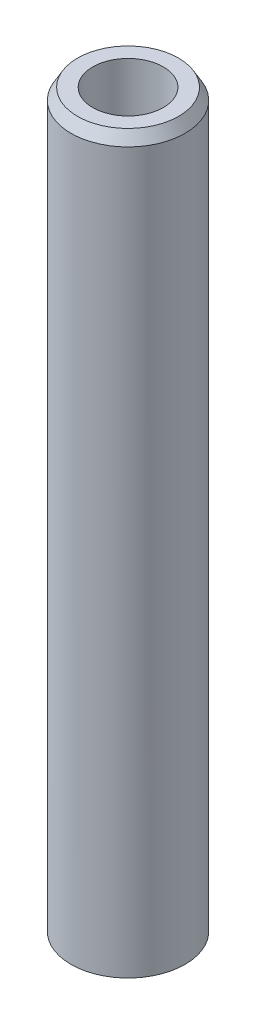
from build123d import *
from OCP.BRepFilletAPI import BRepFilletAPI_MakeChamfer

# Parameters (mm, degrees)
SKETCH1_R           = 25
BOSS_EXTRUDE1_DEPTH = 323.019459308
SKETCH2_R           = 15.452771336
CUT_EXTRUDE1_DEPTH  = 325.94856684
CHAMFER1_SIZE       = 4.986464527
CHAMFER1_SIZE2      = 2.878936637


with BuildPart() as part:
    # Sketch1 → Boss-Extrude1 (new body)
    with BuildSketch(Plane(origin=(0, 0, 0), x_dir=(1, 0, 0), z_dir=(0, 1, 0))):
        Circle(SKETCH1_R)
    extrude(amount=BOSS_EXTRUDE1_DEPTH)

    # Sketch2 → Cut-Extrude1 (cut, through all)
    with BuildSketch(Plane(origin=(0, 0, 0), x_dir=(1, 0, 0), z_dir=(0, 1, 0))):
        Circle(SKETCH2_R)
    extrude(amount=CUT_EXTRUDE1_DEPTH, mode=Mode.SUBTRACT)

    # Chamfer1: one chamfer whose edges measure the first distance from different faces: ONE call of the kernel's chamfer builder (chamfer() names one face for all edges)
    chamfer1_edges_1 = [part.edges().sort_by_distance(p)[0] for p in [
        (-25, 323.019459308, 0),
    ]]
    chamfer1_side_1 = [part.faces().sort_by_distance(p)[0] for p in [
        (-25, 161.509729654, 0),
    ]]
    chamfer1_edges_2 = [part.edges().sort_by_distance(p)[0] for p in [
        (-25, 0, 0),
    ]]
    chamfer1_side_2 = [part.faces().sort_by_distance(p)[0] for p in [
        (-24.292893219, 0, 0),
    ]]
    chamfer1 = BRepFilletAPI_MakeChamfer(part.part.solid().wrapped)
    for e in chamfer1_edges_1:
        chamfer1.Add(CHAMFER1_SIZE, CHAMFER1_SIZE2, e.wrapped, chamfer1_side_1[0].wrapped)  # the first distance lies on this face
    for e in chamfer1_edges_2:
        chamfer1.Add(CHAMFER1_SIZE, CHAMFER1_SIZE2, e.wrapped, chamfer1_side_2[0].wrapped)  # the first distance lies on this face
    add(Compound.cast(chamfer1.Shape()), mode=Mode.REPLACE)


solid = part.part
